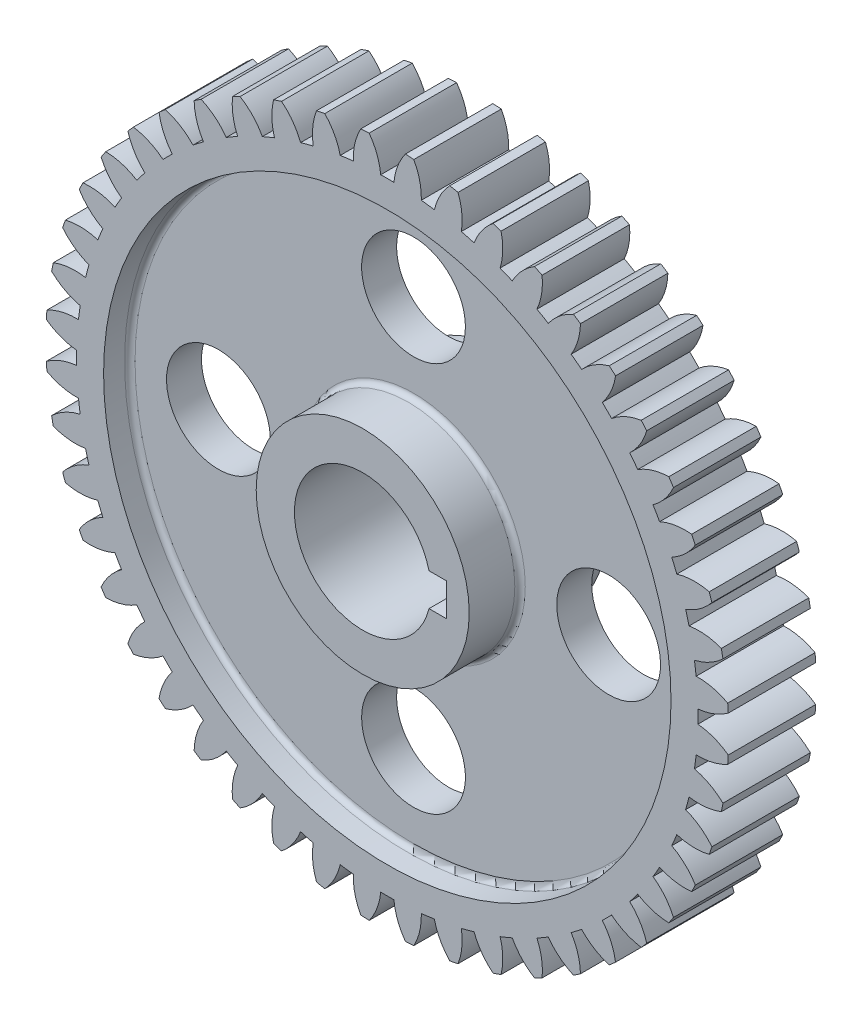
from build123d import *
from build123d.topology import SkipClean

# Parameters (mm, degrees)
BASPROSKE_W       = 16
BASPROSKE_H       = 62.5
TOOTHCUT_DEPTH    = 8
TEETHCUTS_COUNT   = 48
CSKE_R            = 19.5
EXTRUDE_C_DEPTH   = 12.5
BORESKE_R         = 12.5
BORE_DEPTH        = 40
KEYSKE_W          = 15.3
KEYSKE_H          = 6
KEYWAY_DEPTH      = 40
CUT2SKE_R         = 9.5
CUT2_DEPTH        = 8
CIRPATTERN2_COUNT = 4


with BuildPart() as part:
    # BasProSke → Base-Revolve (revolve)
    with BuildSketch(Plane(origin=(0, 0, 0), x_dir=(0, 0, -1), z_dir=(1, 0, 0))):
        with Locations((0, 31.25)):
            Rectangle(BASPROSKE_W, BASPROSKE_H)
    revolve(axis=Axis((0, 0, 53.938223938), (0, 0, -1)))

    # ToothCutSke → ToothCut (cut, symmetric)
    with BuildSketch(Plane.XY):
        with BuildLine():
            ThreePointArc((-1.205663501, 56.862219448), (-1.889262332, 59.778945389), (-3.318403926, 62.41184339))
            ThreePointArc((-3.318403926, 62.41184339), (0, 62.5), (3.318403926, 62.41184339))
            ThreePointArc((3.318403926, 62.41184339), (1.889262332, 59.778945389), (1.205663501, 56.862219448))
            ThreePointArc((1.205663501, 56.862219448), (0, 56.875), (-1.205663501, 56.862219448))
        make_face()
    toothcut = extrude(amount=TOOTHCUT_DEPTH, both=True, mode=Mode.SUBTRACT)

    # TeethCuts: ToothCut ×48 about axis
    teethcuts_axis = Axis((0, 0, 53.938223938), (0, 0, -1))
    for i in range(1, TEETHCUTS_COUNT):
        add(toothcut.rotate(teethcuts_axis, i * 360 / TEETHCUTS_COUNT), mode=Mode.SUBTRACT)

    # CSke → Extrude C (add, symmetric)
    with BuildSketch(Plane.XY):
        Circle(CSKE_R)
    extrude(amount=EXTRUDE_C_DEPTH, both=True)

    # BoreSke → Bore (cut, symmetric)
    with BuildSketch(Plane.XY):
        Circle(BORESKE_R)
    extrude(amount=BORE_DEPTH, both=True, mode=Mode.SUBTRACT)

    # KeySke → Keyway (cut, symmetric)
    with BuildSketch(Plane.XY):
        with Locations((7.65, 0)):
            Rectangle(KEYSKE_W, KEYSKE_H)
    extrude(amount=KEYWAY_DEPTH, both=True, mode=Mode.SUBTRACT)

    # Cut1Ske → Cut1 (revolve, cut)
    with SkipClean():  # the faces are left unmerged after this step: merging them gives an invalid solid
        with BuildSketch(Plane(origin=(0, 0, 0), x_dir=(0, 0, -1), z_dir=(1, 0, 0))):
            with BuildLine():
                Line((-67.2, 51.9375), (-4.16, 51.9375))
                ThreePointArc((-4.16, 51.9375), (-3.48117749, 51.65632251), (-3.2, 50.9775))
                Line((-3.2, 50.9775), (-3.2, 20.46))
                ThreePointArc((-3.2, 20.46), (-3.48117749, 19.78117749), (-4.16, 19.5))
                Line((-4.16, 19.5), (-67.2, 19.5))
                Line((-67.2, 19.5), (-67.2, 51.9375))
            make_face()
            with BuildLine():
                Line((67.2, 19.5), (4.16, 19.5))
                ThreePointArc((4.16, 19.5), (3.48117749, 19.78117749), (3.2, 20.46))
                Line((3.2, 20.46), (3.2, 50.9775))
                ThreePointArc((3.2, 50.9775), (3.48117749, 51.65632251), (4.16, 51.9375))
                Line((4.16, 51.9375), (67.2, 51.9375))
                Line((67.2, 51.9375), (67.2, 19.5))
            make_face()
        revolve(axis=Axis((0, 0, 40.33053973), (0, 0, -1)), mode=Mode.SUBTRACT)

    # Cut2Ske → Cut2 (cut, symmetric)
    with SkipClean():  # the faces are left unmerged after this step: merging them gives an invalid solid
        with BuildSketch(Plane.XY):
            with Locations((0, 35.71875)):
                Circle(CUT2SKE_R)
        cut2 = extrude(amount=CUT2_DEPTH, both=True, mode=Mode.SUBTRACT)

    # CirPattern2: Cut2 ×4 about axis
    with SkipClean():  # the faces are left unmerged after this step: merging them gives an invalid solid
        cirpattern2_axis = Axis((0, 0, 53.938223938), (0, 0, -1))
        for i in range(1, CIRPATTERN2_COUNT):
            add(cut2.rotate(cirpattern2_axis, i * 360 / CIRPATTERN2_COUNT), mode=Mode.SUBTRACT)


solid = part.part
